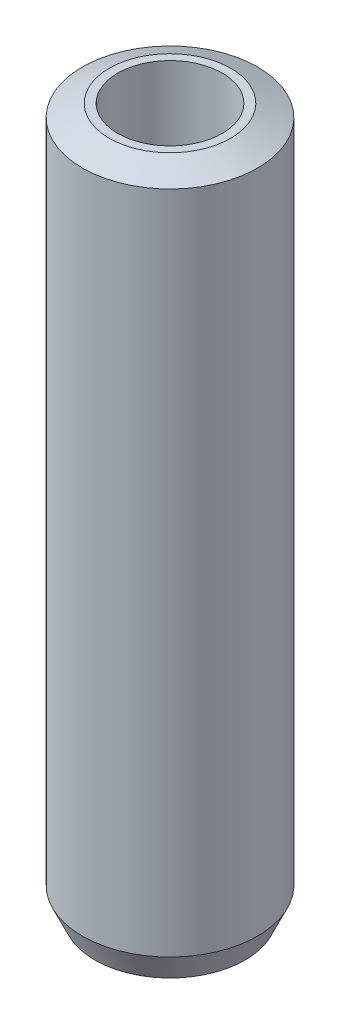
from build123d import *
from OCP.BRepFilletAPI import BRepFilletAPI_MakeChamfer

# Parameters (mm, degrees)
SKETCH1_R           = 37.5
BOSS_EXTRUDE1_DEPTH = 301.515304558
SKETCH2_R           = 22.375558027
CUT_EXTRUDE1_DEPTH  = 307.143722592
CHAMFER1_SIZE       = 5.287036987
CHAMFER1_SIZE2      = 11.516406954


with BuildPart() as part:
    # Sketch1 → Boss-Extrude1 (new body)
    with BuildSketch(Plane(origin=(0, 0, 0), x_dir=(1, 0, 0), z_dir=(0, 1, 0))):
        Circle(SKETCH1_R)
    extrude(amount=BOSS_EXTRUDE1_DEPTH)

    # Sketch2 → Cut-Extrude1 (cut, through all)
    with BuildSketch(Plane(origin=(0, 0, 0), x_dir=(1, 0, 0), z_dir=(0, 1, 0))):
        Circle(SKETCH2_R)
    extrude(amount=CUT_EXTRUDE1_DEPTH, mode=Mode.SUBTRACT)

    # Chamfer1: one chamfer whose edges measure the first distance from different faces: ONE call of the kernel's chamfer builder (chamfer() names one face for all edges)
    chamfer1_edges_1 = [part.edges().sort_by_distance(p)[0] for p in [
        (-37.5, 301.515304558, 0),
    ]]
    chamfer1_side_1 = [part.faces().sort_by_distance(p)[0] for p in [
        (-37.5, 150.757652279, 0),
    ]]
    chamfer1_edges_2 = [part.edges().sort_by_distance(p)[0] for p in [
        (-37.5, 0, 0),
    ]]
    chamfer1_side_2 = [part.faces().sort_by_distance(p)[0] for p in [
        (-36.439339828, 0, 0),
    ]]
    chamfer1 = BRepFilletAPI_MakeChamfer(part.part.solid().wrapped)
    for e in chamfer1_edges_1:
        chamfer1.Add(CHAMFER1_SIZE, CHAMFER1_SIZE2, e.wrapped, chamfer1_side_1[0].wrapped)  # the first distance lies on this face
    for e in chamfer1_edges_2:
        chamfer1.Add(CHAMFER1_SIZE, CHAMFER1_SIZE2, e.wrapped, chamfer1_side_2[0].wrapped)  # the first distance lies on this face
    add(Compound.cast(chamfer1.Shape()), mode=Mode.REPLACE)


solid = part.part
